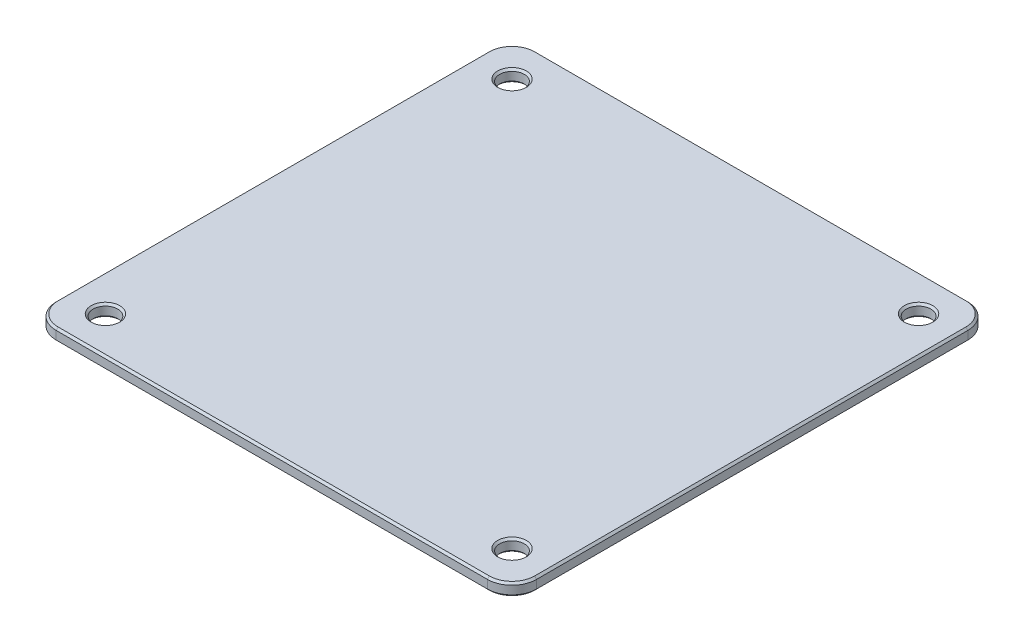
from build123d import *

# Parameters (mm, degrees)
SKETCH2_W           = 61.9125
SKETCH2_H           = 61.9125
SKETCH2_R           = 1.5875
BOSS_EXTRUDE1_DEPTH = 1.5875
FILLET1_R           = 3.175
CHAMFER1_SIZE       = 0.254


with BuildPart() as part:
    # Sketch2 → Boss-Extrude1 (new body)
    with BuildSketch(Plane(origin=(0, 0, 0), x_dir=(1, 0, 0), z_dir=(0, 1, 0))):
        Rectangle(SKETCH2_W, SKETCH2_H)
        with Locations((-26.19375, 26.19375)):
            Circle(SKETCH2_R, mode=Mode.SUBTRACT)
        with Locations((26.19375, 26.19375)):
            Circle(SKETCH2_R, mode=Mode.SUBTRACT)
        with Locations((26.19375, -26.19375)):
            Circle(SKETCH2_R, mode=Mode.SUBTRACT)
        with Locations((-26.19375, -26.19375)):
            Circle(SKETCH2_R, mode=Mode.SUBTRACT)
    extrude(amount=BOSS_EXTRUDE1_DEPTH)

    # Fillet1
    fillet1_edges = [part.edges().sort_by_distance(p)[0] for p in [
        (30.95625, 0.79375, 30.95625),
        (-30.95625, 0.79375, -30.95625),
        (30.95625, 0.79375, -30.95625),
        (-30.95625, 0.79375, 30.95625),
    ]]
    fillet(fillet1_edges, radius=FILLET1_R)

    # Chamfer1
    chamfer1_edges = [part.edges().sort_by_distance(p)[0] for p in [
        (-27.78125, 0, 26.19375),
        (24.60625, 0, -26.19375),
        (30.02631403, 0, -30.02631403),
        (0, 0, -30.95625),
        (-30.02631403, 0, -30.02631403),
        (-30.95625, 0, 0),
        (-30.02631403, 0, 30.02631403),
        (0, 0, 30.95625),
        (30.02631403, 0, 30.02631403),
        (30.95625, 0, 0),
        (-27.78125, 0, -26.19375),
        (24.60625, 0, 26.19375),
        (-27.78125, 1.5875, 26.19375),
        (24.60625, 1.5875, 26.19375),
        (24.60625, 1.5875, -26.19375),
        (-27.78125, 1.5875, -26.19375),
        (-30.02631403, 1.5875, 30.02631403),
        (-30.95625, 1.5875, 0),
        (-30.02631403, 1.5875, -30.02631403),
        (0, 1.5875, -30.95625),
        (30.02631403, 1.5875, -30.02631403),
        (30.95625, 1.5875, 0),
        (30.02631403, 1.5875, 30.02631403),
        (0, 1.5875, 30.95625),
    ]]
    chamfer(chamfer1_edges, length=CHAMFER1_SIZE)


solid = part.part
